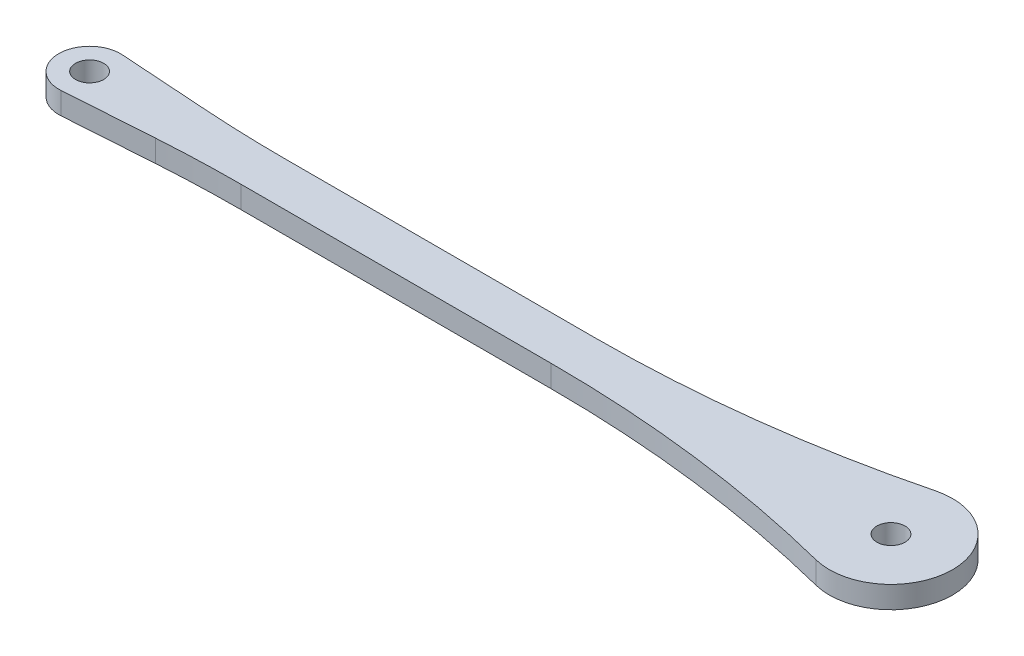
from build123d import *

# Parameters (mm, degrees)
SKETCH1_R           = 2.032
BOSS_EXTRUDE1_DEPTH = 3.175
FILLET2_DEPTH       = 3.175


with BuildPart() as part:
    # Sketch1 → Boss-Extrude1 (new body)
    with BuildSketch(Plane(origin=(0, 0, 0), x_dir=(1, 0, 0), z_dir=(0, 1, 0))):
        with BuildLine():
            Line((-38.735, -3.175), (38.735, -3.175))
            Line((38.735, -3.175), (55.045918919, -8.457513514))
            ThreePointArc((55.045918919, -8.457513514), (66.675, 0), (55.045918919, 8.457513514))
            Line((55.045918919, 8.457513514), (38.735, 3.175))
            Line((38.735, 3.175), (-38.735, 3.175))
            Line((-38.735, 3.175), (-57.486999924, 4.434999544))
            ThreePointArc((-57.486999924, 4.434999544), (-62.23, 0), (-57.486999924, -4.434999544))
            Line((-57.486999924, -4.434999544), (-38.735, -3.175))
        make_face()
        with Locations(Location((-57.785, 0, 0), (0, 0, 270))):
            Circle(SKETCH1_R, mode=Mode.SUBTRACT)
        with Locations(Location((57.785, 0, 0), (0, 0, 270))):
            Circle(SKETCH1_R, mode=Mode.SUBTRACT)
    extrude(amount=BOSS_EXTRUDE1_DEPTH)

    # Fillet2: read off the stored shape, not the designer's step
    # Fillet2 outline → Fillet2 (add)
    with BuildSketch(Plane(origin=(0, 0, 0), x_dir=(1, 0, 0), z_dir=(0, 1, 0))):
        with BuildLine():
            ThreePointArc((55.045918919, 8.457513514), (55.322751331, 8.542214672), (55.602194863, 8.617857143))
            ThreePointArc((55.602194863, 8.617857143), (33.943137383, 4.540961334), (11.946092127, 3.175))
            Line((11.946092127, 3.175), (38.735, 3.175))
            Line((38.735, 3.175), (55.045918919, 8.457513514))
        make_face()
        with BuildLine():
            ThreePointArc((-44.6882895, -3.575018243), (-38.731643046, -3.275032701), (-32.76828646, -3.175))
            Line((-32.76828646, -3.175), (-38.735, -3.175))
            Line((-38.735, -3.175), (-44.6882895, -3.575018243))
        make_face()
        with BuildLine():
            ThreePointArc((11.946092127, -3.175), (33.943137383, -4.540961334), (55.602194863, -8.617857143))
            ThreePointArc((55.602194863, -8.617857143), (55.322751331, -8.542214672), (55.045918919, -8.457513514))
            Line((55.045918919, -8.457513514), (38.735, -3.175))
            Line((38.735, -3.175), (11.946092127, -3.175))
        make_face()
        with BuildLine():
            Line((-38.735, 3.175), (-32.76828646, 3.175))
            ThreePointArc((-32.76828646, 3.175), (-38.731643046, 3.275032701), (-44.6882895, 3.575018243))
            Line((-44.6882895, 3.575018243), (-38.735, 3.175))
        make_face()
    extrude(amount=FILLET2_DEPTH)


solid = part.part
